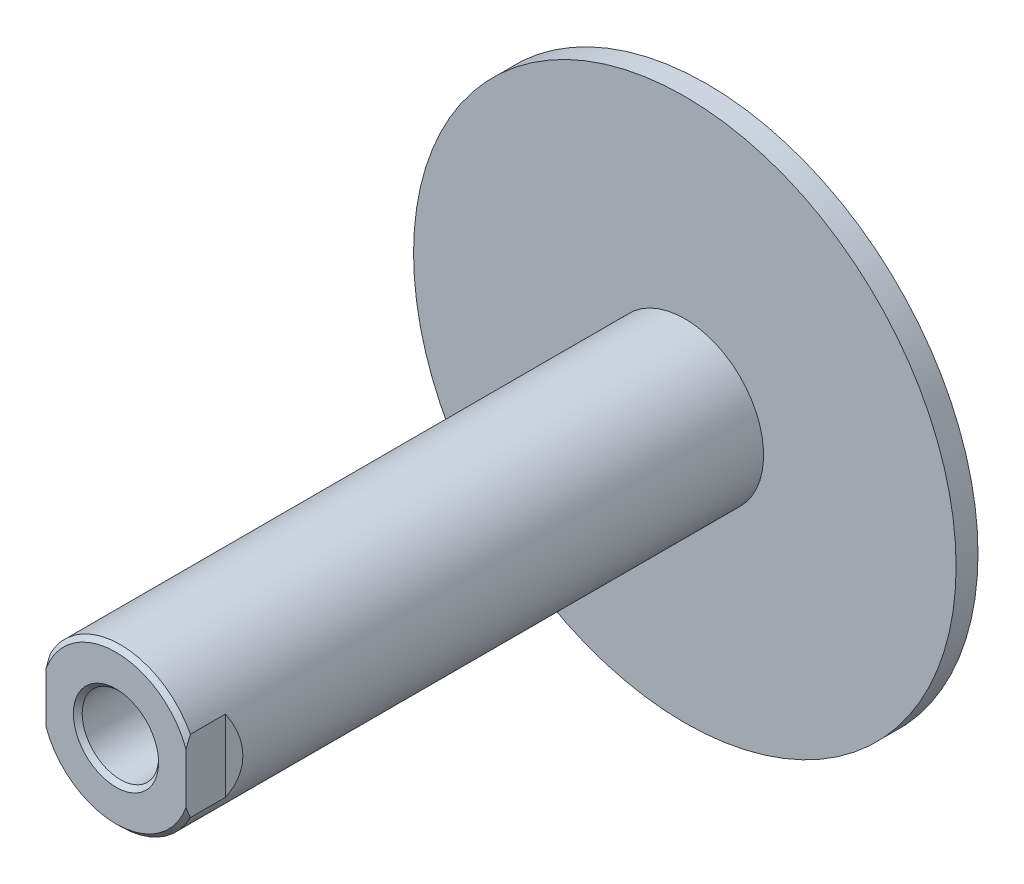
from build123d import *

# Parameters (mm, degrees)
SKETCH1_R                   = 18
BASE_EXTRUDE_DEPTH          = 5
SKETCH6_R                   = 18
SKETCH6_R_2                 = 17
CUT_EXTRUDE1_DEPTH          = 1
SKETCH7_R                   = 18
BOSS_EXTRUDE1_DEPTH         = 130
CHAMFER1_SIZE               = 1
SKETCH2_W                   = 10
SKETCH2_H                   = 30
WRENCHFLATS_DEPTH           = 11
WRENCHFLATSCHAMFER_SIZE     = 2
SKETCH3_R                   = 5
INTERNALTHREAD_DEPTH        = 30
INTERNALTHREADCHAMFER_SIZE  = 1.2
PISTON_OUTLINE_W            = 44
PISTON_OUTLINE_H            = 5
F_3_4_16_TAPPED_HOLE1_D     = 17.4625
F_3_4_16_TAPPED_HOLE1_DEPTH = 34.76
F_3_4_16_TAPPED_HOLE1_TIP   = 5.24626428
CHAMFER2_SIZE               = 1


# Read off the part's stored shape, not the designer's step: Piston
with BuildPart() as part:
    # Sketch1 → Base-Extrude (new body)
    with BuildSketch(Plane.XY):
        Circle(SKETCH1_R)
    extrude(amount=BASE_EXTRUDE_DEPTH)

    # Sketch6 → Cut-Extrude1 (cut)
    with BuildSketch(Plane(origin=(0, 0, 0), x_dir=(-1, 0, 0), z_dir=(0, 0, -1))):
        Circle(SKETCH6_R)
        Circle(SKETCH6_R_2, mode=Mode.SUBTRACT)
    extrude(amount=-CUT_EXTRUDE1_DEPTH, mode=Mode.SUBTRACT)

    # Sketch7 → Boss-Extrude1 (add)
    with BuildSketch(Plane.XY.offset(5)):
        with Locations(Location((0, 0, 0), (0, 0, 180))):
            Circle(SKETCH7_R)
    extrude(amount=BOSS_EXTRUDE1_DEPTH)

    # Chamfer1
    chamfer1_edges = [part.edges().sort_by_distance(p)[0] for p in [
        (18, 0, 135),
    ]]
    chamfer(chamfer1_edges, length=CHAMFER1_SIZE)

    # Sketch2 → WrenchFlats (cut)
    with BuildSketch(Plane.XY.offset(135)):
        with Locations((21, 0)):
            Rectangle(SKETCH2_W, SKETCH2_H)
        with Locations((-21, 0)):
            Rectangle(SKETCH2_W, SKETCH2_H)
    extrude(amount=-WRENCHFLATS_DEPTH, mode=Mode.SUBTRACT)

    # WrenchFlatsChamfer
    wrenchflatschamfer_edges = [part.edges().sort_by_distance(p)[0] for p in [
        (16, 0, 124),
        (-16, 0, 124),
    ]]
    chamfer(wrenchflatschamfer_edges, length=WRENCHFLATSCHAMFER_SIZE - 0.0001)  # a hair under: the kernel refuses the full size

    # Sketch3 → InternalThread (cut)
    with BuildSketch(Plane.XY.offset(135)):
        Circle(SKETCH3_R)
    extrude(amount=-INTERNALTHREAD_DEPTH, mode=Mode.SUBTRACT)

    # InternalThreadChamfer
    internalthreadchamfer_edges = [part.edges().sort_by_distance(p)[0] for p in [
        (-5, 0, 135),
    ]]
    chamfer(internalthreadchamfer_edges, length=INTERNALTHREADCHAMFER_SIZE)

    # Piston outline → Piston (revolve)
    with BuildSketch(Plane.XZ):
        with Locations((40, 2.5)):
            Rectangle(PISTON_OUTLINE_W, PISTON_OUTLINE_H)
    revolve(axis=Axis((0, 0, 0), (0, 0, 1)))

    # 3/4-16 Tapped Hole1
    with Locations(Plane.XY.offset(135)):
        with Locations((0, 0)):
            Hole(F_3_4_16_TAPPED_HOLE1_D / 2, depth=F_3_4_16_TAPPED_HOLE1_DEPTH)
            with Locations((0, 0, -(F_3_4_16_TAPPED_HOLE1_DEPTH + F_3_4_16_TAPPED_HOLE1_TIP / 2))):  # 118° drill point
                Cone(0, F_3_4_16_TAPPED_HOLE1_D / 2, F_3_4_16_TAPPED_HOLE1_TIP, mode=Mode.SUBTRACT)

    # Chamfer2
    chamfer2_edges = [part.edges().sort_by_distance(p)[0] for p in [
        (8.73125, 0, 135),
    ]]
    chamfer(chamfer2_edges, length=CHAMFER2_SIZE)


solid = part.part
